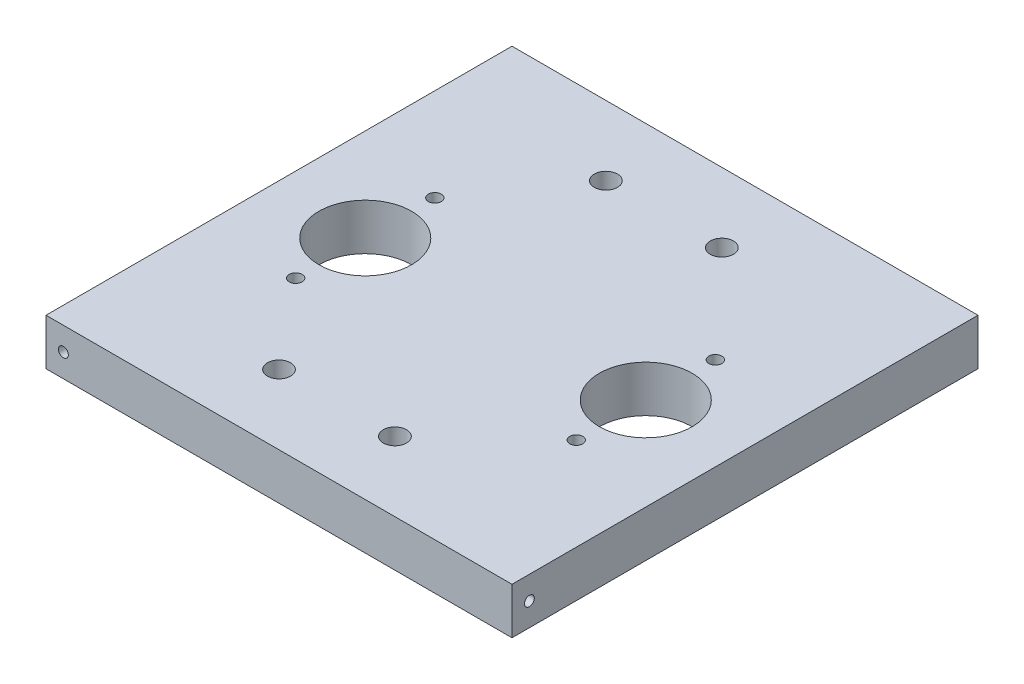
from build123d import *

# Parameters (mm, degrees)
SKETCH1_W                      = 127.635
SKETCH1_H                      = 127.635
MAIN_PLATE_DEPTH               = 12.7
SKETCH2_R                      = 3.175
U_BOLT_HOLE_DEPTH              = 12.7
U_BOLT_PATTERN_COUNT           = 2
U_BOLT_PATTERN_PITCH           = 31.75
U_BOLT_PATTERN_COUNT_DIR2      = 2
U_BOLT_PATTERN_PITCH_DIR2      = 89.535
SKETCH3_R                      = 1.778
RAPTOR_BOLT_HOLE_DEPTH         = 12.7
RAPTOR_BOLT_PATTERN_COUNT      = 2
RAPTOR_BOLT_PATTERN_PITCH      = 38.1
RAPTOR_BOLT_PATTERN_COUNT_DIR2 = 2
RAPTOR_BOLT_PATTERN_PITCH_DIR2 = 76.835
SKETCH4_R                      = 12.7
CO2_CYLINDER_HOLE_DEPTH        = 12.7
CO2_PATTERN_COUNT              = 2
CO2_PATTERN_PITCH              = 76.835
SKETCH5_R                      = 1.35255
FRAME_ATTACHMENT_HOLE_1_DEPTH  = 12.7
SKETCH6_R                      = 1.35255
FRAME_ATTACHMENT_HOLE_2_DEPTH  = 12.7
SKETCH7_R                      = 1.35255
FRAME_ATTACHMENT_HOLE_3_DEPTH  = 12.7
SKETCH8_R                      = 1.35255
FRAME_ATTACHMENT_HOLE_4_DEPTH  = 12.7


with BuildPart() as part:
    # Sketch1 → Main Plate (new body)
    with BuildSketch(Plane(origin=(0, 0, 0), x_dir=(1, 0, 0), z_dir=(0, 1, 0))):
        with Locations((63.8175, 63.8175)):
            Rectangle(SKETCH1_W, SKETCH1_H)
    extrude(amount=MAIN_PLATE_DEPTH)

    # Sketch2 → U-Bolt Hole (cut)
    with BuildSketch(Plane(origin=(0, 12.7, 0), x_dir=(1, 0, 0), z_dir=(0, 1, 0))):
        with Locations((44.7675, 108.585)):
            Circle(SKETCH2_R)
    u_bolt_hole = extrude(amount=-U_BOLT_HOLE_DEPTH, mode=Mode.SUBTRACT)

    # U-Bolt Pattern: U-Bolt Hole 2 × 2
    with Locations(*[(i * U_BOLT_PATTERN_PITCH, 0, j * U_BOLT_PATTERN_PITCH_DIR2) for i in range(U_BOLT_PATTERN_COUNT) for j in range(U_BOLT_PATTERN_COUNT_DIR2) if (i, j) != (0, 0)]):
        add(u_bolt_hole, mode=Mode.SUBTRACT)

    # Sketch3 → Raptor Bolt Hole (cut)
    with BuildSketch(Plane(origin=(0, 12.7, 0), x_dir=(1, 0, 0), z_dir=(0, 1, 0))):
        with Locations((25.4, 42.9895)):
            Circle(SKETCH3_R)
    raptor_bolt_hole = extrude(amount=-RAPTOR_BOLT_HOLE_DEPTH, mode=Mode.SUBTRACT)

    # Raptor Bolt Pattern: Raptor Bolt Hole 2 × 2
    with Locations(*[(j * RAPTOR_BOLT_PATTERN_PITCH_DIR2, 0, -i * RAPTOR_BOLT_PATTERN_PITCH) for i in range(RAPTOR_BOLT_PATTERN_COUNT) for j in range(RAPTOR_BOLT_PATTERN_COUNT_DIR2) if (i, j) != (0, 0)]):
        add(raptor_bolt_hole, mode=Mode.SUBTRACT)

    # Sketch4 → Co2 Cylinder Hole (cut)
    with BuildSketch(Plane(origin=(0, 12.7, 0), x_dir=(1, 0, 0), z_dir=(0, 1, 0))):
        with Locations((25.4, 62.0395)):
            Circle(SKETCH4_R)
    co2_cylinder_hole = extrude(amount=-CO2_CYLINDER_HOLE_DEPTH, mode=Mode.SUBTRACT)

    # Co2 Pattern: Co2 Cylinder Hole ×2
    with Locations(*[(i * CO2_PATTERN_PITCH, 0, 0) for i in range(1, CO2_PATTERN_COUNT)]):
        add(co2_cylinder_hole, mode=Mode.SUBTRACT)

    # Sketch5 → Frame attachment hole 1 (cut)
    with BuildSketch(Plane.XY):
        with Locations((4.7625, 6.35)):
            Circle(SKETCH5_R)
    extrude(amount=-FRAME_ATTACHMENT_HOLE_1_DEPTH, mode=Mode.SUBTRACT)

    # Sketch6 → Frame attachment hole 2 (cut)
    with BuildSketch(Plane.ZY):
        with Locations((-122.8725, 6.35)):
            Circle(SKETCH6_R)
    extrude(amount=-FRAME_ATTACHMENT_HOLE_2_DEPTH, mode=Mode.SUBTRACT)

    # Sketch7 → Frame attachment hole 3 (cut)
    with BuildSketch(Plane(origin=(0, 0, -127.635), x_dir=(-1, 0, 0), z_dir=(0, 0, -1))):
        with Locations((-122.8725, 6.35)):
            Circle(SKETCH7_R)
    extrude(amount=-FRAME_ATTACHMENT_HOLE_3_DEPTH, mode=Mode.SUBTRACT)

    # Sketch8 → Frame attachment hole 4 (cut)
    with BuildSketch(Plane(origin=(127.635, 0, 0), x_dir=(0, 0, -1), z_dir=(1, 0, 0))):
        with Locations((4.7625, 6.35)):
            Circle(SKETCH8_R)
    extrude(amount=-FRAME_ATTACHMENT_HOLE_4_DEPTH, mode=Mode.SUBTRACT)


solid = part.part
